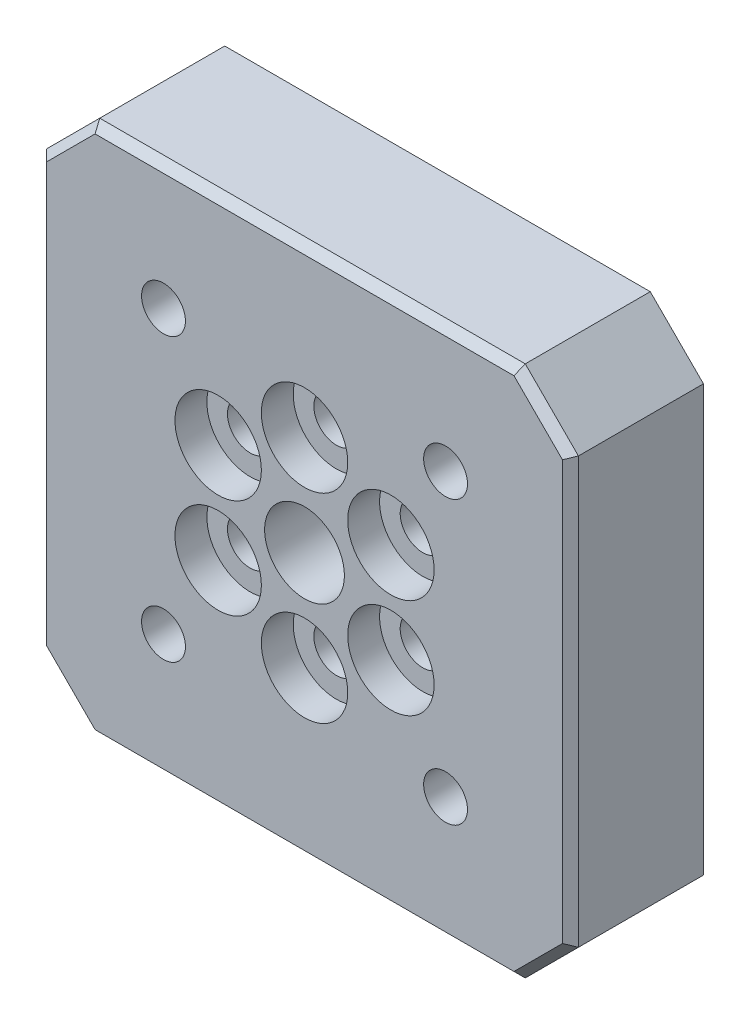
from build123d import *

# Parameters (mm, degrees)
SKETCH1_W                                            = 40
SKETCH1_H                                            = 40
BOSS_EXTRUDE1_DEPTH                                  = 10
F_6_0MM_DOWEL_HOLE1_D                                = 6
CBORE_FOR_M3_HEX_SOCKET_THIN_HEAD_CAP_SC_D           = 3.4
CBORE_FOR_M3_HEX_SOCKET_THIN_HEAD_CAP_SC_CBORE_D     = 6.5
CBORE_FOR_M3_HEX_SOCKET_THIN_HEAD_CAP_SC_CBORE_DEPTH = 2.4
TAP_DRILL_FOR_M4_TAP1_D                              = 3.3
CHAMFER1_SIZE                                        = 4
CHAMFER2_SIZE                                        = 0.6


with BuildPart() as part:
    # Sketch1 → Boss-Extrude1 (new body)
    with BuildSketch(Plane.XY):
        with Locations((20, 20)):
            Rectangle(SKETCH1_W, SKETCH1_H)
    extrude(amount=BOSS_EXTRUDE1_DEPTH)

    # Ø6.0mm Dowel Hole1 (through all)
    with Locations(Plane.XY.offset(10)):
        with Locations((20, 20)):
            Hole(F_6_0MM_DOWEL_HOLE1_D / 2)

    # CBORE for M3 Hex Socket Thin Head Cap Screw4 (through all)
    with Locations(Plane.XY.offset(10)):
        with Locations((20, 27.5), (26.495190528, 23.75), (26.495190528, 16.25), (20, 12.5), (13.504809472, 16.25), (13.504809472, 23.75)):
            CounterBoreHole(CBORE_FOR_M3_HEX_SOCKET_THIN_HEAD_CAP_SC_D / 2, CBORE_FOR_M3_HEX_SOCKET_THIN_HEAD_CAP_SC_CBORE_D / 2, CBORE_FOR_M3_HEX_SOCKET_THIN_HEAD_CAP_SC_CBORE_DEPTH)

    # Tap Drill for M4 Tap1 (through all)
    with Locations(Plane.XY.offset(10)):
        with Locations((9.393398282, 30.606601718), (30.606601718, 30.606601718), (30.606601718, 9.393398282), (9.393398282, 9.393398282)):
            Hole(TAP_DRILL_FOR_M4_TAP1_D / 2)

    # Chamfer1
    chamfer1_edges = [part.edges().sort_by_distance(p)[0] for p in [
        (40, 0, 5),
        (40, 40, 5),
        (0, 0, 5),
        (0, 40, 5),
    ]]
    chamfer(chamfer1_edges, length=CHAMFER1_SIZE)

    # Chamfer2
    chamfer2_edges = [part.edges().sort_by_distance(p)[0] for p in [
        (40, 20, 10),
        (38, 38, 10),
        (38, 2, 10),
        (20, 0, 10),
        (2, 2, 10),
        (0, 20, 10),
        (2, 38, 10),
        (20, 40, 10),
    ]]
    chamfer(chamfer2_edges, length=CHAMFER2_SIZE)


solid = part.part
